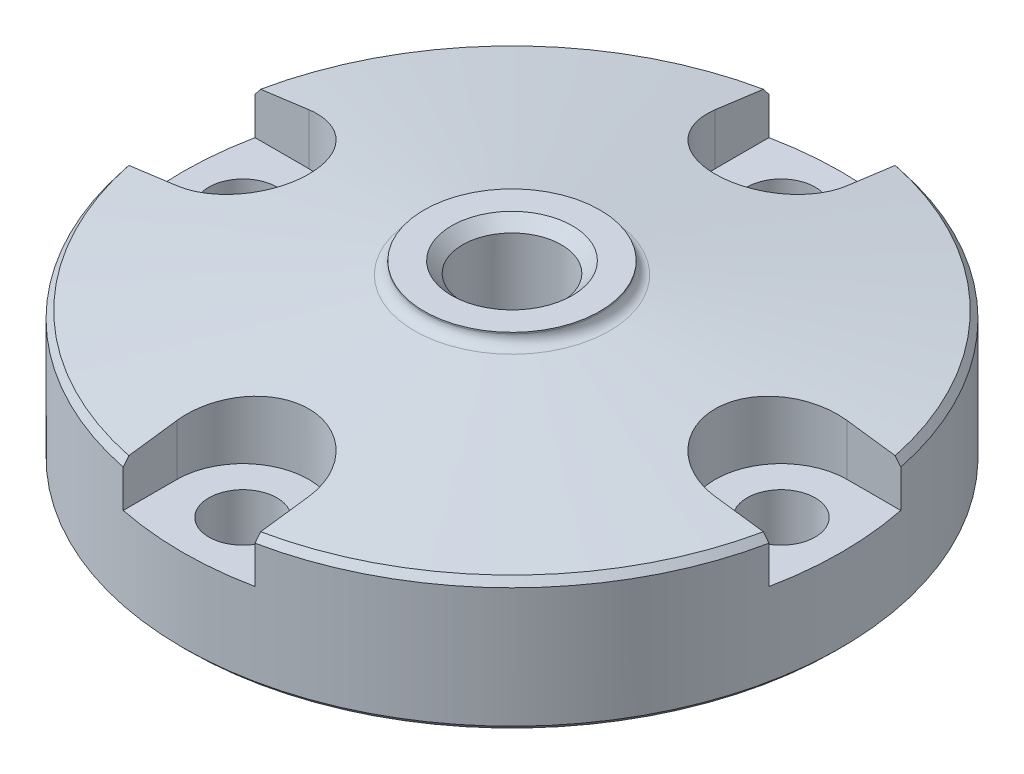
from build123d import *

# Parameters (mm, degrees)
SKETCH_1_R               = 15
EXTRUDE_314_DEPTH        = 8
SKETCH_3_R               = 10
CUT_EXTRUDE_1_DEPTH      = 2.5
SKETCH_5_R               = 9
CUT_EXTRUDE_3_DEPTH      = 1
SKETCH_6_R               = 4
EXTRUDE_2_DEPTH          = 1.5
SKETCH_7_R               = 2.25
CUT_EXTRUDE_4_DEPTH      = 23.671568098
CHAMFER_3_SIZE           = 0.5
CHAMFER_4_SIZE           = 0.25
CHAMFER_4_SIZE2          = 0.292152675
CHAMFER_5_SIZE           = 0.25
FILLET_1_R               = 0.5
CUT_EXTRUDE_START        = 4
CUT_EXTRUDE_6_DEPTH      = 19.671568265
SKETCH_9_R               = 1.55
CUT_EXTRUDE_7_DEPTH      = 22.587033302
PATTERN_CIRCULAR_1_COUNT = 4


with BuildPart() as part:
    # Эскиз1 → Extrude 314 (new body)
    with BuildSketch(Plane(origin=(0, 0, 0), x_dir=(1, 0, 0), z_dir=(0, 1, 0))):
        Circle(SKETCH_1_R)
    extrude(amount=EXTRUDE_314_DEPTH)

    # Эскиз2 → Вырез-Повернуть1 (revolve, cut)
    with BuildSketch(Plane.XY):
        Polygon((4, 8), (15, 8), (15, 6), (4, 7.5), align=None)
    revolve(axis=Axis((0, -1.597938144, 0), (0, 1, 0)), mode=Mode.SUBTRACT)

    # Эскиз3 → Вырез-Вытянуть1 (cut)
    with BuildSketch(Plane(origin=(0, 0, 0), x_dir=(-1, 0, 0), z_dir=(0, -1, 0))):
        Circle(SKETCH_3_R)
    extrude(amount=-CUT_EXTRUDE_1_DEPTH, mode=Mode.SUBTRACT)

    # Эскиз5 → Вырез-Вытянуть3 (cut)
    with BuildSketch(Plane.XZ.offset(-2.5)):
        Circle(SKETCH_5_R)
    extrude(amount=-CUT_EXTRUDE_3_DEPTH, mode=Mode.SUBTRACT)

    # Эскиз6 → Бобышка-Вытянуть2 (add)
    with BuildSketch(Plane.XZ.offset(-3.5)):
        Circle(SKETCH_6_R)
    extrude(amount=EXTRUDE_2_DEPTH)

    # Эскиз7 → Вырез-Вытянуть4 (cut, through all)
    with BuildSketch(Plane(origin=(0, 8, 0), x_dir=(1, 0, 0), z_dir=(0, 1, 0))):
        Circle(SKETCH_7_R)
    extrude(amount=-CUT_EXTRUDE_4_DEPTH, mode=Mode.SUBTRACT)

    # Фаска3
    chamfer_3_edges = [part.edges().sort_by_distance(p)[0] for p in [
        (-2.25, 8, 0),
    ]]
    chamfer(chamfer_3_edges, length=CHAMFER_3_SIZE)

    # Фаска4
    chamfer_4_edges = [part.edges().sort_by_distance(p)[0] for p in [
        (-15, 6, 0),
    ]]
    chamfer_4_side = [part.faces().sort_by_distance(p)[0] for p in [
        (-9.5, 6.75, 0),
    ]]
    chamfer(chamfer_4_edges, length=CHAMFER_4_SIZE, length2=CHAMFER_4_SIZE2, reference=chamfer_4_side[0])

    # Фаска5
    chamfer_5_edges = [part.edges().sort_by_distance(p)[0] for p in [
        (-15, 0, 0),
    ]]
    chamfer(chamfer_5_edges, length=CHAMFER_5_SIZE)

    # Скругление1
    fillet_1_edges = [part.edges().sort_by_distance(p)[0] for p in [
        (-4, 7.5, 0),
    ]]
    fillet(fillet_1_edges, radius=FILLET_1_R)

    # Эскиз8 → Вырез-Вытянуть6 (cut, through all)
    with BuildSketch(Plane(origin=(0, 0, 0), x_dir=(1, 0, 0), z_dir=(0, 1, 0)).offset(CUT_EXTRUDE_START)):
        with BuildLine():
            Line((3, 12.25), (3, 14.696938457))
            ThreePointArc((3, 14.696938457), (0, 15), (-3, 14.696938457))
            Line((-3, 14.696938457), (-3, 12.25))
            ThreePointArc((-3, 12.25), (0, 9.25), (3, 12.25))
        make_face()
    cut_extrude_6 = extrude(amount=CUT_EXTRUDE_6_DEPTH, mode=Mode.SUBTRACT)

    # Эскиз9 → Вырез-Вытянуть7 (cut, through all)
    with BuildSketch(Plane(origin=(0, 4, 0), x_dir=(1, 0, 0), z_dir=(0, 1, 0))):
        with Locations((0, 12.25)):
            Circle(SKETCH_9_R)
    cut_extrude_7 = extrude(amount=-CUT_EXTRUDE_7_DEPTH, mode=Mode.SUBTRACT)

    # Круговой массив1: Вырез-Вытянуть6, Вырез-Вытянуть7 ×4 about axis
    pattern_circular_1_axis = Axis((0, 5.707847325, 0), (0, -1, 0))
    add([cut_extrude_6.rotate(pattern_circular_1_axis, i * 360 / PATTERN_CIRCULAR_1_COUNT) for i in range(1, PATTERN_CIRCULAR_1_COUNT)], mode=Mode.SUBTRACT)
    add([cut_extrude_7.rotate(pattern_circular_1_axis, i * 360 / PATTERN_CIRCULAR_1_COUNT) for i in range(1, PATTERN_CIRCULAR_1_COUNT)], mode=Mode.SUBTRACT)


solid = part.part
